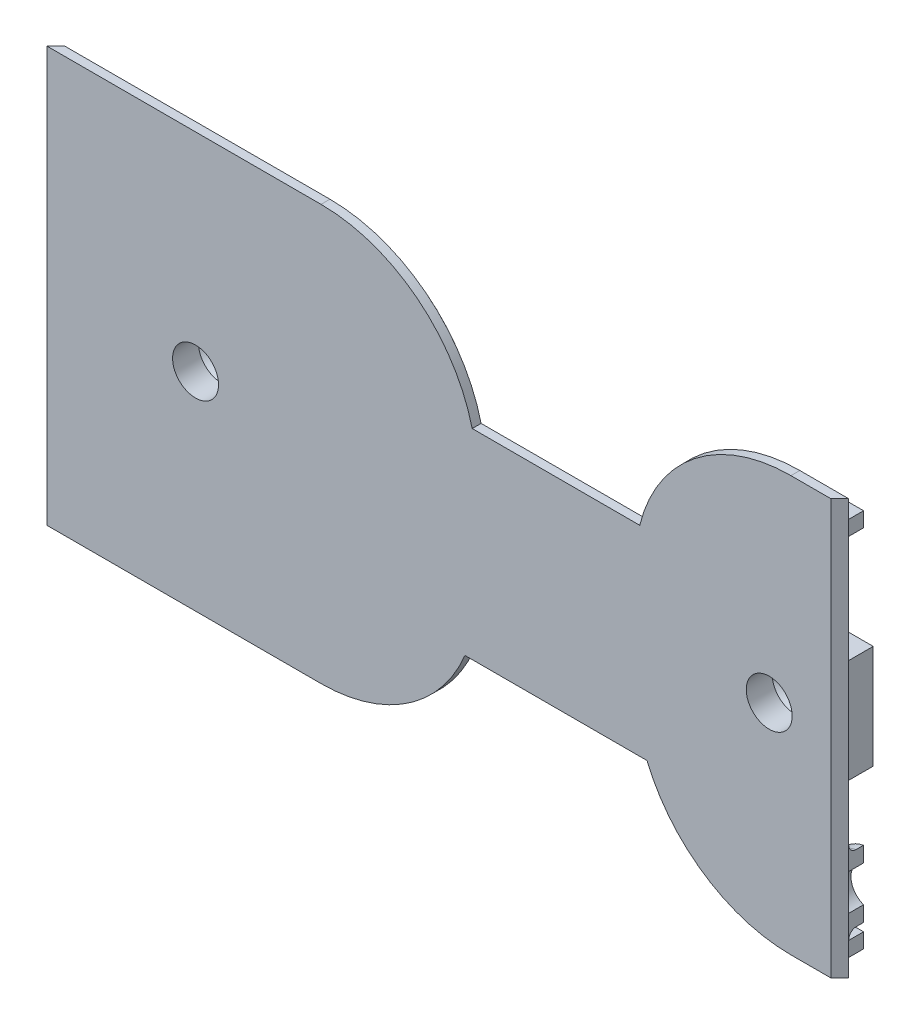
from build123d import *

# Parameters (mm, degrees)
SKETCH_2_R            = 2.6
EXTRUDE_1_DEPTH       = 1.2
EXTRUDE_1_2_DEPTH     = 2
CUT_EXTRUDE_START     = -2
CUT_EXTRUDE_1_DEPTH   = 2
SKETCH_5_W            = 2
SKETCH_5_H            = 47.2
CUT_EXTRUDE_1_2_DEPTH = 2
SKETCH_6_W            = 14.43
SKETCH_6_H            = 14
SKETCH_6_R            = 2.6
EXTRUDE_2_DEPTH       = 5.4
SKETCH_7_R            = 3
SKETCH_7_R_2          = 2
EXTRUDE_2_2_DEPTH     = 2
SKETCH_8_R            = 3.1
CUT_EXTRUDE_2_DEPTH   = 4.6
CHAMFER_1_SIZE        = 1.1
SKETCH_10_R           = 4.6
SKETCH_10_R_2         = 2
EXTRUDE_3_DEPTH       = 2
SKETCH_11_R           = 2.6
SKETCH_11_R_2         = 2
CUT_EXTRUDE_2_2_DEPTH = 2
CUT_EXTRUDE_3_DEPTH   = 62
SKETCH_13_W           = 1.2
SKETCH_13_H           = 2
CUT_EXTRUDE_4_DEPTH   = 62
CUT_EXTRUDE_5_DEPTH   = 62
CUT_EXTRUDE_6_DEPTH   = 2
FILLET_1_R            = 1


# Read off the part's stored shape, not the designer's step: Вытянуть-Тонкостенный1
# Some blends are built 0.0001 mm under size
with BuildPart() as part:
    # Эскиз2 → Extrude 1 (new body)
    with BuildSketch(Plane.XY):
        with BuildLine():
            Line((-31.7, 28), (-69.1, 28))
            Line((-69.1, 28), (-69.1, -28))
            Line((-69.1, -28), (-31.7, -28))
            ThreePointArc((-31.7, -28), (-20.016678554, -24.449928367), (-12.283512161, -15))
            Line((-12.283512161, -15), (-10.3, -15))
            Line((-10.3, -15), (12.283512161, -15))
            ThreePointArc((12.283512161, -15), (20.016678554, -24.449928367), (31.7, -28))
            Line((31.7, -28), (38.7, -28))
            Line((38.7, -28), (38.7, 0))
            Line((38.7, 0), (38.7, 28))
            Line((38.7, 28), (31.7, 28))
            ThreePointArc((31.7, 28), (18.738518603, 23.522711642), (11.303921946, 12))
            Line((11.303921946, 12), (-10.3, 12))
            Line((-10.3, 12), (-11.303921946, 12))
            ThreePointArc((-11.303921946, 12), (-18.738518603, 23.522711642), (-31.7, 28))
        make_face()
        with Locations((28.77, 0)):
            Circle(SKETCH_2_R, mode=Mode.SUBTRACT)
        with Locations((-48.63, 0)):
            Circle(SKETCH_2_R, mode=Mode.SUBTRACT)
    extrude(amount=-EXTRUDE_1_DEPTH)

    # Extrude 1 2 outline → Extrude 1 2 (add)
    with BuildSketch(Plane(origin=(0, 0, -1.2), x_dir=(-1, 0, 0), z_dir=(0, 0, -1))):
        with BuildLine():
            Line((-32.7, 26), (-38.7, 26))
            Line((-38.7, 26), (-38.7, -26))
            Line((-38.7, -26), (-32.7, -26))
            ThreePointArc((-32.7, -26), (-21.298245749, -22.431676725), (-13.965006005, -13))
            Line((-13.965006005, -13), (-13.965006005, -12.6))
            Line((-13.965006005, -12.6), (-12.3, -12.6))
            Line((-12.3, -12.6), (-12.3, -10.6))
            Line((-12.3, -10.6), (13.236187424, -10.6))
            ThreePointArc((13.236187424, -10.6), (20.290326354, -21.684387141), (32.7, -26))
            Line((32.7, -26), (69.1, -26))
            Line((69.1, -26), (69.1, 26))
            Line((69.1, 26), (32.7, 26))
            ThreePointArc((32.7, 26), (19.135340034, 20.696938457), (12.764102729, 7.6))
            Line((12.764102729, 7.6), (-12.3, 7.6))
            Line((-12.3, 7.6), (-12.3, 9.6))
            Line((-12.3, 9.6), (-13.104082058, 9.6))
            Line((-13.104082058, 9.6), (-13.104082058, 10))
            ThreePointArc((-13.104082058, 10), (-20.050889359, 21.491933385), (-32.7, 26))
        make_face()
        with BuildLine():
            Line((-36.3, 23.6), (-32.7, 23.6))
            ThreePointArc((-32.7, 23.6), (-21.659961191, 19.706842929), (-15.504082058, 9.749720806))
            Line((-15.504082058, 9.749720806), (-15.504082058, 7.2))
            Line((-15.504082058, 7.2), (-14.7, 7.2))
            Line((-14.7, 7.2), (-14.7, 5.2))
            Line((-14.7, 5.2), (15.118191219, 5.2))
            ThreePointArc((15.118191219, 5.2), (19.975221024, 18.158947323), (32.7, 23.6))
            Line((32.7, 23.6), (66.7, 23.6))
            Line((66.7, 23.6), (66.7, -23.6))
            Line((66.7, -23.6), (32.7, -23.6))
            ThreePointArc((32.7, -23.6), (21.058694231, -19.2), (15.238041347, -8.2))
            Line((15.238041347, -8.2), (-14.7, -8.2))
            Line((-14.7, -8.2), (-14.7, -10.2))
            Line((-14.7, -10.2), (-16.365006005, -10.2))
            Line((-16.365006005, -10.2), (-16.365006005, -12.551944076))
            ThreePointArc((-16.365006005, -12.551944076), (-22.839833058, -20.578652471), (-32.7, -23.6))
            Line((-32.7, -23.6), (-36.3, -23.6))
            Line((-36.3, -23.6), (-36.3, 23.6))
        make_face(mode=Mode.SUBTRACT)
    extrude(amount=EXTRUDE_1_2_DEPTH)

    # Эскиз4 → Cut-Extrude 1 (cut)
    with BuildSketch(Plane(origin=(0, 0, -3.2), x_dir=(-1, 0, 0), z_dir=(0, 0, -1)).offset(CUT_EXTRUDE_START)):
        with BuildLine():
            Line((12.764102729, 7.6), (-12.3, 7.6))
            Line((-12.3, 7.6), (-12.3, 9.6))
            Line((-12.3, 9.6), (-13.104082058, 9.6))
            Line((-13.104082058, 9.6), (-13.104082058, 10))
            ThreePointArc((-13.104082058, 10), (-20.050889359, 21.491933385), (-32.7, 26))
            Line((-32.7, 26), (-38.7, 26))
            Line((-38.7, 26), (-38.7, -26))
            Line((-38.7, -26), (-32.7, -26))
            ThreePointArc((-32.7, -26), (-21.298245749, -22.431676725), (-13.965006005, -13))
            Line((-13.965006005, -13), (-13.965006005, -12.6))
            Line((-13.965006005, -12.6), (-12.3, -12.6))
            Line((-12.3, -12.6), (-12.3, -10.6))
            Line((-12.3, -10.6), (13.236187424, -10.6))
            ThreePointArc((13.236187424, -10.6), (20.290326354, -21.684387141), (32.7, -26))
            Line((32.7, -26), (69.1, -26))
            Line((69.1, -26), (69.1, 26))
            Line((69.1, 26), (32.7, 26))
            ThreePointArc((32.7, 26), (19.135340034, 20.696938457), (12.764102729, 7.6))
        make_face()
        with BuildLine():
            Line((13.136769183, 7.2), (-12.7, 7.2))
            Line((-12.7, 7.2), (-12.7, 9.2))
            Line((-12.7, 9.2), (-13.504082058, 9.2))
            Line((-13.504082058, 9.2), (-13.504082058, 9.959385603))
            ThreePointArc((-13.504082058, 9.959385603), (-20.319449887, 21.194801049), (-32.7, 25.6))
            Line((-32.7, 25.6), (-38.3, 25.6))
            Line((-38.3, 25.6), (-38.3, -25.6))
            Line((-38.3, -25.6), (-32.7, -25.6))
            ThreePointArc((-32.7, -25.6), (-21.555849098, -22.123520108), (-14.365006005, -12.927336804))
            Line((-14.365006005, -12.927336804), (-14.365006005, -12.2))
            Line((-14.365006005, -12.2), (-12.7, -12.2))
            Line((-12.7, -12.2), (-12.7, -10.2))
            Line((-12.7, -10.2), (13.555287936, -10.2))
            ThreePointArc((13.555287936, -10.2), (20.415049858, -21.27219696), (32.7, -25.6))
            Line((32.7, -25.6), (68.7, -25.6))
            Line((68.7, -25.6), (68.7, 25.6))
            Line((68.7, 25.6), (32.7, 25.6))
            ThreePointArc((32.7, 25.6), (19.271671735, 20.277254638), (13.136769183, 7.2))
        make_face(mode=Mode.SUBTRACT)
    extrude(amount=CUT_EXTRUDE_1_DEPTH, mode=Mode.SUBTRACT)

    # Эскиз5 → Cut-Extrude 1 2 (cut)
    with BuildSketch(Plane(origin=(0, 0, -3.2), x_dir=(-1, 0, 0), z_dir=(0, 0, -1))):
        with Locations((67.7, 0)):
            Rectangle(SKETCH_5_W, SKETCH_5_H)
        with Locations((-37.3, 0)):
            Rectangle(SKETCH_5_W, SKETCH_5_H)
    extrude(amount=-CUT_EXTRUDE_1_2_DEPTH, mode=Mode.SUBTRACT)

    # Эскиз6 → Extrude 2 (add)
    # profile 1 of 2: a face of its own
    with BuildSketch(Plane(origin=(0, 0, -1.2), x_dir=(-1, 0, 0), z_dir=(0, 0, -1))):
        with Locations((-28.985, 0)):
            Rectangle(SKETCH_6_W, SKETCH_6_H)
        with Locations(Location((-28.77, 0, 0), (0, 0, 180))):
            Circle(SKETCH_6_R, mode=Mode.SUBTRACT)
    # profile 2 of 2: a face of its own
    with BuildSketch(Plane(origin=(0, 0, -1.2), x_dir=(-1, 0, 0), z_dir=(0, 0, -1))):
        with Locations((48.415, 0)):
            Rectangle(SKETCH_6_W, SKETCH_6_H)
        with Locations(Location((48.63, 0, 0), (0, 0, 180))):
            Circle(SKETCH_6_R, mode=Mode.SUBTRACT)
    extrude(amount=EXTRUDE_2_DEPTH)

    # Эскиз7 → Extrude 2 2 (add)
    # profile 1 of 2: a face of its own
    with BuildSketch(Plane(origin=(0, 0, -6.6), x_dir=(-1, 0, 0), z_dir=(0, 0, -1))):
        with Locations((-28.77, 0)):
            Circle(SKETCH_7_R)
        with Locations((-28.77, 0)):
            Circle(SKETCH_7_R_2, mode=Mode.SUBTRACT)
    # profile 2 of 2: a face of its own
    with BuildSketch(Plane(origin=(0, 0, -6.6), x_dir=(-1, 0, 0), z_dir=(0, 0, -1))):
        with Locations((48.63, 0)):
            Circle(SKETCH_7_R)
        with Locations((48.63, 0)):
            Circle(SKETCH_7_R_2, mode=Mode.SUBTRACT)
    extrude(amount=-EXTRUDE_2_2_DEPTH)

    # Эскиз8 → Cut-Extrude 2 (cut)
    with BuildSketch(Plane.XY):
        with Locations((-48.63, 0)):
            Circle(SKETCH_8_R)
        with Locations((28.77, 0)):
            Circle(SKETCH_8_R)
    extrude(amount=-CUT_EXTRUDE_2_DEPTH, mode=Mode.SUBTRACT)

    # Фаска1
    chamfer_1_edges = [part.edges().sort_by_distance(p)[0] for p in [
        (-51.73, 0, -4.6),
        (25.67, 0, -4.6),
    ]]
    chamfer(chamfer_1_edges, length=CHAMFER_1_SIZE - 0.0001)  # a hair under: the kernel refuses the full size

    # Эскиз10 → Вытянуть-Тонкостенный3 (add)
    # profile 1 of 3: a face of its own
    with BuildSketch(Plane(origin=(0, 0, -1.2), x_dir=(-1, 0, 0), z_dir=(0, 0, -1))):
        with Locations((-39.2, -18)):
            Circle(SKETCH_10_R)
        with Locations((-39.2, -18)):
            Circle(SKETCH_10_R_2, mode=Mode.SUBTRACT)
    # profile 2 of 3: a face of its own
    with BuildSketch(Plane(origin=(0, 0, -1.2), x_dir=(-1, 0, 0), z_dir=(0, 0, -1))):
        with Locations((-31.2, -18)):
            Circle(SKETCH_10_R)
        with Locations((-31.2, -18)):
            Circle(SKETCH_10_R_2, mode=Mode.SUBTRACT)
    # profile 3 of 3: a face of its own
    with BuildSketch(Plane(origin=(0, 0, -1.2), x_dir=(-1, 0, 0), z_dir=(0, 0, -1))):
        with Locations((-31.2, -10)):
            Circle(SKETCH_10_R)
        with Locations((-31.2, -10)):
            Circle(SKETCH_10_R_2, mode=Mode.SUBTRACT)
    extrude(amount=EXTRUDE_3_DEPTH)

    # Эскиз11 → Cut-Extrude 2 2 (cut)
    # profile 1 of 3: a face of its own
    with BuildSketch(Plane(origin=(0, 0, -3.2), x_dir=(-1, 0, 0), z_dir=(0, 0, -1)).offset(CUT_EXTRUDE_START)):
        with Locations((-39.2, -18)):
            Circle(SKETCH_11_R)
        with Locations((-39.2, -18)):
            Circle(SKETCH_11_R_2, mode=Mode.SUBTRACT)
    # profile 2 of 3: a face of its own
    with BuildSketch(Plane(origin=(0, 0, -3.2), x_dir=(-1, 0, 0), z_dir=(0, 0, -1)).offset(CUT_EXTRUDE_START)):
        with Locations((-31.2, -18)):
            Circle(SKETCH_11_R)
        with Locations((-31.2, -18)):
            Circle(SKETCH_11_R_2, mode=Mode.SUBTRACT)
    # profile 3 of 3: a face of its own
    with BuildSketch(Plane(origin=(0, 0, -3.2), x_dir=(-1, 0, 0), z_dir=(0, 0, -1)).offset(CUT_EXTRUDE_START)):
        with Locations((-31.2, -10)):
            Circle(SKETCH_11_R)
        with Locations((-31.2, -10)):
            Circle(SKETCH_11_R_2, mode=Mode.SUBTRACT)
    extrude(amount=CUT_EXTRUDE_2_2_DEPTH, mode=Mode.SUBTRACT)

    # Эскиз12 → Вырез-Вытянуть3 (cut)
    with BuildSketch(Plane.XZ.offset(28)):
        Polygon((-68.7, 0), (-67.5, -1.2), (-69.1, -1.2), (-69.1, 0), align=None)
    extrude(amount=-CUT_EXTRUDE_3_DEPTH, mode=Mode.SUBTRACT)

    # Эскиз13 → Вырез-Вытянуть4 (cut)
    with BuildSketch(Plane.XZ.offset(25.6)):
        with Locations((-68.1, -2.2)):
            Rectangle(SKETCH_13_W, SKETCH_13_H)
    extrude(amount=-CUT_EXTRUDE_4_DEPTH, mode=Mode.SUBTRACT)

    # Эскиз14 → Вырез-Вытянуть5 (cut)
    with BuildSketch(Plane.XZ.offset(28)):
        Polygon((38.7, -1.2), (38.7, 0), (37.1, 0), (38.3, -1.2), align=None)
    extrude(amount=-CUT_EXTRUDE_5_DEPTH, mode=Mode.SUBTRACT)

    # Эскиз15 → Вырез-Вытянуть6 (cut)
    with BuildSketch(Plane.XY.offset(-1.2)):
        with BuildLine():
            Line((38.3, -13.488902573), (38.3, -22.511097427))
            ThreePointArc((38.3, -22.511097427), (43.8, -18), (38.3, -13.488902573))
        make_face()
    extrude(amount=-CUT_EXTRUDE_6_DEPTH, mode=Mode.SUBTRACT)

    # Скругление1
    # the kernel refuses this fillet: 1 mm, written as the material it adds along each edge
    with BuildSketch(Plane(origin=(31.2, -10, -1.2), x_dir=(-0.3113315217302437, 0.9503013646086861, 0), z_dir=(0.9503013646086861, 0.3113315217302437, 0))) as fillet_1_piece_1_section:
        with BuildLine():
            CenterArc((4.6 + FILLET_1_R, -FILLET_1_R), FILLET_1_R, 90, 90)
            Line((4.6, -FILLET_1_R), (4.6, 0))
            Line((4.6, 0), (4.6 + FILLET_1_R, 0))
        make_face()
    fillet_1_piece_1 = revolve(axis=Axis((31.2, -10, -1.2), (0, 0, 1)), revolution_arc=163.423462372, mode=Mode.PRIVATE)
    fillet_1_piece_1 = fillet_1_piece_1 - Plane(origin=(31.2, -18, -1.484354145), x_dir=(-1, 0, 0), z_dir=(0, 0, 1)) * Cylinder(4.6, 23, mode=Mode.PRIVATE)
    add(fillet_1_piece_1)
    with BuildSketch(Plane(origin=(31.2, -10, -1.2), x_dir=(-0.027275325587206686, -0.9996279590998403, 0), z_dir=(-0.9996279590998403, 0.027275325587206686, 0))) as fillet_1_piece_2_section:
        with BuildLine():
            CenterArc((4.6 + FILLET_1_R, -FILLET_1_R), FILLET_1_R, 90, 90)
            Line((4.6, -FILLET_1_R), (4.6, 0))
            Line((4.6, 0), (4.6 + FILLET_1_R, 0))
        make_face()
    fillet_1_piece_2 = revolve(axis=Axis((31.2, -10, -1.2), (0, 0, 1)), revolution_arc=163.423462372, mode=Mode.PRIVATE)
    fillet_1_piece_2 = fillet_1_piece_2 - Plane(origin=(31.2, -18, -1.484354149), x_dir=(-1, 0, 0), z_dir=(0, 0, 1)) * Cylinder(4.6, 23, mode=Mode.PRIVATE)
    add(fillet_1_piece_2)
    with BuildSketch(Plane(origin=(39.2, -18, -1.2), x_dir=(-0.999633679916253, -0.02706484762732944, 0), z_dir=(0.02706484762732944, -0.999633679916253, 0))) as fillet_1_piece_3_section:
        with BuildLine():
            CenterArc((4.6 + FILLET_1_R, FILLET_1_R), FILLET_1_R, 180, 90)
            Line((4.6, FILLET_1_R), (4.6, 0))
            Line((4.6, 0), (4.6 + FILLET_1_R, 0))
        make_face()
    fillet_1_piece_3 = revolve(axis=Axis((39.2, -18, -1.2), (0, 0, -1)), revolution_arc=111.410803348, mode=Mode.PRIVATE)
    fillet_1_piece_3 = split(fillet_1_piece_3, bisect_by=Plane(origin=(38.3, -14.154293852, -1.420542647), z_dir=(-1, 0, 0)), keep=Keep.TOP, mode=Mode.PRIVATE)
    fillet_1_piece_3 = fillet_1_piece_3 - Plane(origin=(31.2, -18, -1.420542647), x_dir=(-1, 0, 0), z_dir=(0, 0, 1)) * Cylinder(4.6, 23, mode=Mode.PRIVATE)
    add(fillet_1_piece_3)
    with BuildSketch(Plane(origin=(31.2, -18, -1.2), x_dir=(0.9996347466688221, -0.027025418634317382, 0), z_dir=(-0.027025418634317382, -0.9996347466688221, 0))) as fillet_1_piece_4_section:
        with BuildLine():
            CenterArc((4.6 + FILLET_1_R, -FILLET_1_R), FILLET_1_R, 90, 90)
            Line((4.6, -FILLET_1_R), (4.6, 0))
            Line((4.6, 0), (4.6 + FILLET_1_R, 0))
        make_face()
    fillet_1_piece_4 = revolve(axis=Axis((31.2, -18, -1.2), (0, 0, 1)), revolution_arc=93.097261959, mode=Mode.PRIVATE)
    fillet_1_piece_4 = fillet_1_piece_4 - Plane(origin=(31.2, -10, -1.427452975), x_dir=(-1, 0, 0), z_dir=(0, 0, 1)) * Cylinder(4.6, 23, mode=Mode.PRIVATE)
    fillet_1_piece_4 = fillet_1_piece_4 - Plane(origin=(39.2, -18, -1.427452975), x_dir=(-1, 0, 0), z_dir=(0, 0, 1)) * Cylinder(4.6, 23, mode=Mode.PRIVATE)
    add(fillet_1_piece_4)
    with BuildSketch(Plane(origin=(31.2, -18, -1.2), x_dir=(0.028198782541565014, 0.9996023352629653, 0), z_dir=(0.9996023352629653, -0.028198782541565014, 0))) as fillet_1_piece_5_section:
        with BuildLine():
            CenterArc((4.6 + FILLET_1_R, -FILLET_1_R), FILLET_1_R, 90, 90)
            Line((4.6, -FILLET_1_R), (4.6, 0))
            Line((4.6, 0), (4.6 + FILLET_1_R, 0))
        make_face()
    fillet_1_piece_5 = revolve(axis=Axis((31.2, -18, -1.2), (0, 0, 1)), revolution_arc=273.231770853, mode=Mode.PRIVATE)
    fillet_1_piece_5 = fillet_1_piece_5 - Plane(origin=(39.2, -18, -1.481900137), x_dir=(-1, 0, 0), z_dir=(0, 0, 1)) * Cylinder(2.6, 23, mode=Mode.PRIVATE)
    fillet_1_piece_5 = fillet_1_piece_5 - Plane(origin=(31.2, -10, -1.481900137), x_dir=(-1, 0, 0), z_dir=(0, 0, 1)) * Cylinder(4.6, 23, mode=Mode.PRIVATE)
    add(fillet_1_piece_5)
    with BuildSketch(Plane(origin=(39.2, -18, -1.2), x_dir=(0.33972158483368087, -0.9405260468472375, 0), z_dir=(0.9405260468472375, 0.33972158483368087, 0))) as fillet_1_piece_6_section:
        with BuildLine():
            CenterArc((4.6 + FILLET_1_R, FILLET_1_R), FILLET_1_R, 180, 90)
            Line((4.6, FILLET_1_R), (4.6, 0))
            Line((4.6, 0), (4.6 + FILLET_1_R, 0))
        make_face()
    fillet_1_piece_6 = revolve(axis=Axis((39.2, -18, -1.2), (0, 0, -1)), revolution_arc=111.410803348, mode=Mode.PRIVATE)
    fillet_1_piece_6 = split(fillet_1_piece_6, bisect_by=Plane(origin=(38.3, -21.84570589, -1.420542541), z_dir=(-1, 0, 0)), keep=Keep.TOP, mode=Mode.PRIVATE)
    fillet_1_piece_6 = fillet_1_piece_6 - Plane(origin=(31.2, -18, -1.420542541), x_dir=(-1, 0, 0), z_dir=(0, 0, 1)) * Cylinder(4.6, 23, mode=Mode.PRIVATE)
    add(fillet_1_piece_6)


solid = part.part
